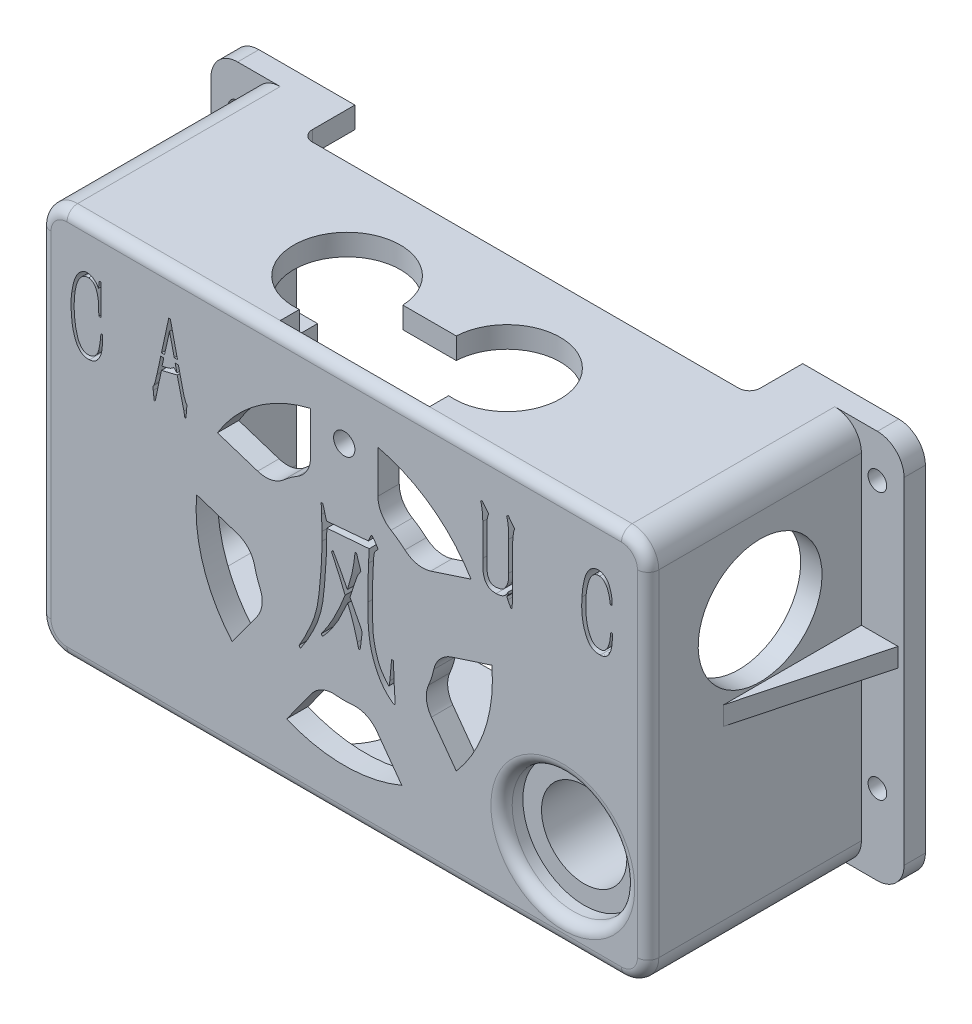
from build123d import *

# Parameters (mm, degrees)
SKETCH_1_R           = 1.75
EXTRUDE_1_DEPTH      = 4
EXTRUDE_2_DEPTH      = 36
EXTRUDE_START        = -15
SKETCH_3_R           = 8
EXTRUDE_3_DEPTH      = 15
SKETCH_4_R           = 11.5
EXTRUDE_4_DEPTH      = 4
FILLET_1_R           = 2
CUT_EXTRUDE_1_DEPTH  = 100
SKETCH_8_R           = 10
CUT_EXTRUDE_2_DEPTH  = 100
SKETCH_9_R           = 9.298841846
CUT_EXTRUDE_3_DEPTH  = 4
SKETCH_10_R          = 11.613625498
CUT_EXTRUDE_4_DEPTH  = 4
CUT_EXTRUDE_5_DEPTH  = 4
CUT_EXTRUDE_6_DEPTH  = 4
CUT_EXTRUDE_9_DEPTH  = 4
SKETCH_18_W          = 28
SKETCH_18_H          = 14
CUT_EXTRUDE_10_DEPTH = 4
SKETCH_19_R          = 2
CUT_EXTRUDE_11_DEPTH = 4
SKETCH_20_W          = 1.60747687
SKETCH_20_H          = 0.595361804
SKETCH_20_W_2        = 1.763369689
SKETCH_20_H_2        = 0.790958503
EXTRUDE_5_DEPTH      = 4
SKETCH_21_W          = 4
SKETCH_21_H          = 7
EXTRUDE_6_DEPTH      = 5
EXTRUDE_8_DEPTH      = 3.5
SKETCH_24_W          = 9.548890683
SKETCH_24_H          = 8
CUT_EXTRUDE_12_DEPTH = 4
FILLET_2_R           = 2


with BuildPart() as part:
    # 草图1 → 凸台-拉伸1 (new body)
    with BuildSketch(Plane.XY):
        with BuildLine():
            Line((-98.4546875, 27.486072711), (21.5453125, 27.486072711))
            ThreePointArc((21.5453125, 27.486072711), (25.080846406, 26.021606617), (26.5453125, 22.486072711))
            Line((26.5453125, 22.486072711), (26.5453125, -40.513927289))
            ThreePointArc((26.5453125, -40.513927289), (25.080846406, -44.049461195), (21.5453125, -45.513927289))
            Line((21.5453125, -45.513927289), (-98.4546875, -45.513927289))
            ThreePointArc((-98.4546875, -45.513927289), (-101.990221406, -44.049461195), (-103.4546875, -40.513927289))
            Line((-103.4546875, -40.513927289), (-103.4546875, 22.486072711))
            ThreePointArc((-103.4546875, 22.486072711), (-101.990221406, 26.021606617), (-98.4546875, 27.486072711))
        make_face()
        with Locations((-98.4546875, 19.486072711)):
            Circle(SKETCH_1_R, mode=Mode.SUBTRACT)
        with Locations((-98.4546875, -30.513927289)):
            Circle(SKETCH_1_R, mode=Mode.SUBTRACT)
        with Locations((21.5453125, 19.486072711)):
            Circle(SKETCH_1_R, mode=Mode.SUBTRACT)
        with Locations((21.5453125, -30.513927289)):
            Circle(SKETCH_1_R, mode=Mode.SUBTRACT)
        with BuildLine():
            Line((-86.4546875, 23.486072711), (9.5453125, 23.486072711))
            ThreePointArc((9.5453125, 23.486072711), (13.080846406, 22.021606617), (14.5453125, 18.486072711))
            Line((14.5453125, 18.486072711), (14.5453125, -36.513927289))
            ThreePointArc((14.5453125, -36.513927289), (13.080846406, -40.049461195), (9.5453125, -41.513927289))
            Line((9.5453125, -41.513927289), (-86.4546875, -41.513927289))
            ThreePointArc((-86.4546875, -41.513927289), (-89.990221406, -40.049461195), (-91.4546875, -36.513927289))
            Line((-91.4546875, -36.513927289), (-91.4546875, 18.486072711))
            ThreePointArc((-91.4546875, 18.486072711), (-89.990221406, 22.021606617), (-86.4546875, 23.486072711))
        make_face(mode=Mode.SUBTRACT)
    extrude(amount=EXTRUDE_1_DEPTH)

    # 草图2 → 凸台-拉伸2 (add)
    with BuildSketch(Plane.XY.offset(4)):
        with BuildLine():
            Line((-90.4546875, 27.486072711), (13.5453125, 27.486072711))
            ThreePointArc((13.5453125, 27.486072711), (17.080846406, 26.021606617), (18.5453125, 22.486072711))
            Line((18.5453125, 22.486072711), (18.5453125, -40.513927289))
            ThreePointArc((18.5453125, -40.513927289), (17.080846406, -44.049461195), (13.5453125, -45.513927289))
            Line((13.5453125, -45.513927289), (-90.4546875, -45.513927289))
            ThreePointArc((-90.4546875, -45.513927289), (-93.990221406, -44.049461195), (-95.4546875, -40.513927289))
            Line((-95.4546875, -40.513927289), (-95.4546875, 22.486072711))
            ThreePointArc((-95.4546875, 22.486072711), (-93.990221406, 26.021606617), (-90.4546875, 27.486072711))
        make_face()
        with BuildLine():
            Line((-86.4546875, 23.486072711), (9.5453125, 23.486072711))
            ThreePointArc((9.5453125, 23.486072711), (13.080846406, 22.021606617), (14.5453125, 18.486072711))
            Line((14.5453125, 18.486072711), (14.5453125, -36.513927289))
            ThreePointArc((14.5453125, -36.513927289), (13.080846406, -40.049461195), (9.5453125, -41.513927289))
            Line((9.5453125, -41.513927289), (-86.4546875, -41.513927289))
            ThreePointArc((-86.4546875, -41.513927289), (-89.990221406, -40.049461195), (-91.4546875, -36.513927289))
            Line((-91.4546875, -36.513927289), (-91.4546875, 18.486072711))
            ThreePointArc((-91.4546875, 18.486072711), (-89.990221406, 22.021606617), (-86.4546875, 23.486072711))
        make_face(mode=Mode.SUBTRACT)
    extrude(amount=EXTRUDE_2_DEPTH)

    # 草图3 → 凸台-拉伸3 (add)
    with BuildSketch(Plane.XY.offset(40).offset(EXTRUDE_START)):
        with BuildLine():
            Line((13.5453125, -45.513927289), (-9.4546875, -45.513927289))
            Line((-9.4546875, -45.513927289), (-9.4546875, -22.513927289))
            ThreePointArc((-9.4546875, -22.513927289), (-7.990221406, -18.978393383), (-4.4546875, -17.513927289))
            Line((-4.4546875, -17.513927289), (18.5453125, -17.513927289))
            Line((18.5453125, -17.513927289), (18.5453125, -40.513927289))
            ThreePointArc((18.5453125, -40.513927289), (17.080846406, -44.049461195), (13.5453125, -45.513927289))
        make_face()
        with Locations((2.5453125, -29.513927289)):
            Circle(SKETCH_3_R, mode=Mode.SUBTRACT)
    extrude(amount=EXTRUDE_3_DEPTH)

    # 草图4 → 凸台-拉伸4 (add)
    with BuildSketch(Plane.XY.offset(40)):
        with BuildLine():
            Line((-90.4546875, -45.513927289), (13.5453125, -45.513927289))
            ThreePointArc((13.5453125, -45.513927289), (17.080846406, -44.049461195), (18.5453125, -40.513927289))
            Line((18.5453125, -40.513927289), (18.5453125, 22.486072711))
            ThreePointArc((18.5453125, 22.486072711), (17.080846406, 26.021606617), (13.5453125, 27.486072711))
            Line((13.5453125, 27.486072711), (-90.4546875, 27.486072711))
            ThreePointArc((-90.4546875, 27.486072711), (-93.990221406, 26.021606617), (-95.4546875, 22.486072711))
            Line((-95.4546875, 22.486072711), (-95.4546875, -40.513927289))
            ThreePointArc((-95.4546875, -40.513927289), (-93.990221406, -44.049461195), (-90.4546875, -45.513927289))
        make_face()
        with Locations((2.5453125, -29.513927289)):
            Circle(SKETCH_4_R, mode=Mode.SUBTRACT)
    extrude(amount=EXTRUDE_4_DEPTH)

    # 圆角1
    fillet_1_edges = [part.edges().sort_by_distance(p)[0] for p in [
        (-8.9546875, -29.513927289, 44),
        (18.5453125, -9.013927289, 44),
        (17.080846406, -44.049461195, 44),
        (-38.4546875, -45.513927289, 44),
        (-93.990221406, -44.049461195, 44),
        (-95.4546875, -9.013927289, 44),
        (-93.990221406, 26.021606617, 44),
        (-38.4546875, 27.486072711, 44),
        (17.080846406, 26.021606617, 44),
    ]]
    fillet(fillet_1_edges, radius=FILLET_1_R)

    # 草图5 → 切除-拉伸1 (cut)
    with BuildSketch(Plane.XZ.offset(45.513927289)):
        with BuildLine():
            Line((-80.4546875, 0), (3.5453125, 0))
            Line((3.5453125, 0), (3.5453125, 2))
            Line((3.5453125, 2), (3.5453125, 8))
            ThreePointArc((3.5453125, 8), (2.959526062, 9.414213562), (1.5453125, 10))
            Line((1.5453125, 10), (-78.4546875, 10))
            ThreePointArc((-78.4546875, 10), (-79.868901062, 9.414213562), (-80.4546875, 8))
            Line((-80.4546875, 8), (-80.4546875, 2))
            Line((-80.4546875, 2), (-80.4546875, 0))
        make_face()
    extrude(amount=-CUT_EXTRUDE_1_DEPTH, mode=Mode.SUBTRACT)

    # 草图8 → 切除-拉伸2 (cut)
    with BuildSketch(Plane.XZ.offset(45.513927289)):
        with Locations((-53.4546875, 28.467259799)):
            Circle(SKETCH_8_R)
        with Locations((-23.4546875, 28.467259799)):
            Circle(SKETCH_8_R)
    extrude(amount=-CUT_EXTRUDE_2_DEPTH, mode=Mode.SUBTRACT)

    # 草图9 → 切除-拉伸3 (cut)
    with BuildSketch(Plane.ZY.offset(95.4546875)):
        with Locations((23, 9.298841846)):
            Circle(SKETCH_9_R)
        with Locations((23, -20.701158154)):
            Circle(SKETCH_9_R)
    extrude(amount=-CUT_EXTRUDE_3_DEPTH, mode=Mode.SUBTRACT)

    # 草图10 → 切除-拉伸4 (cut)
    with BuildSketch(Plane(origin=(18.5453125, 0, 0), x_dir=(0, 0, -1), z_dir=(1, 0, 0))):
        with Locations((-23, 6.381763577)):
            Circle(SKETCH_10_R)
    extrude(amount=-CUT_EXTRUDE_4_DEPTH, mode=Mode.SUBTRACT)

    # 草图11 → 切除-拉伸5 (cut)
    with BuildSketch(Plane.XY.offset(44)):
        with BuildLine():
            Line((-32.137855058, 18.04582168), (-32.137855058, 10.106075082))
            ThreePointArc((-32.137855058, 10.106075082), (-31.481458567, 7.629563714), (-29.684611635, 5.803281695))
            ThreePointArc((-29.684611635, 5.803281695), (-28.334126115, 4.915830426), (-27.072786827, 3.905679896))
            ThreePointArc((-27.072786827, 3.905679896), (-24.780633174, 2.761129093), (-22.222493228, 2.902143033))
            Line((-22.222493228, 2.902143033), (-14.671345489, 5.355659663))
            ThreePointArc((-14.671345489, 5.355659663), (-22.121739862, 13.466446547), (-32.137855058, 18.04582168))
        make_face()
        with BuildLine():
            Line((-44.771519942, 18.04582168), (-44.771519942, 10.106075082))
            ThreePointArc((-44.771519942, 10.106075082), (-45.427916433, 7.629563714), (-47.224763365, 5.803281695))
            ThreePointArc((-47.224763365, 5.803281695), (-48.575248885, 4.915830426), (-49.836588173, 3.905679896))
            ThreePointArc((-49.836588173, 3.905679896), (-52.128741826, 2.761129093), (-54.686881772, 2.902143033))
            Line((-54.686881772, 2.902143033), (-62.238029511, 5.355659662))
            ThreePointArc((-62.238029511, 5.355659662), (-54.787635138, 13.466446547), (-44.771519942, 18.04582168))
        make_face()
        with BuildLine():
            Line((-10.767328339, -6.659669651), (-18.318476078, -9.113186281))
            ThreePointArc((-18.318476078, -9.113186281), (-20.470940681, -10.50274054), (-21.652581858, -12.775995704))
            ThreePointArc((-21.652581858, -12.775995704), (-22.079275194, -14.334621281), (-22.650210162, -15.846379911))
            ThreePointArc((-22.650210162, -15.846379911), (-23.030428229, -18.380033229), (-22.105807286, -20.769393189))
            Line((-22.105807286, -20.769393189), (-17.438941329, -27.192783118))
            ThreePointArc((-17.438941329, -27.192783118), (-12.027423086, -17.600666015), (-10.767328339, -6.659669651))
        make_face()
        with BuildLine():
            Line((-27.659790922, -34.618665019), (-32.326656879, -28.195275091))
            ThreePointArc((-32.326656879, -28.195275091), (-34.313349654, -26.577555484), (-36.840490996, -26.156222421))
            ThreePointArc((-36.840490996, -26.156222421), (-38.4546875, -26.232054735), (-40.068884004, -26.156222421))
            ThreePointArc((-40.068884004, -26.156222421), (-42.596025346, -26.577555484), (-44.582718121, -28.195275091))
            Line((-44.582718121, -28.195275091), (-49.249584078, -34.618665019))
            ThreePointArc((-49.249584078, -34.618665019), (-38.4546875, -36.801197511), (-27.659790922, -34.618665019))
        make_face()
        with BuildLine():
            Line((-59.470433671, -27.192783118), (-54.803567714, -20.769393189))
            ThreePointArc((-54.803567714, -20.769393189), (-53.878946771, -18.380033229), (-54.259164838, -15.846379911))
            ThreePointArc((-54.259164838, -15.846379911), (-54.830099806, -14.334621281), (-55.256793142, -12.775995704))
            ThreePointArc((-55.256793142, -12.775995704), (-56.438434319, -10.50274054), (-58.590898922, -9.113186281))
            Line((-58.590898922, -9.113186281), (-66.142046661, -6.659669651))
            ThreePointArc((-66.142046661, -6.659669651), (-64.881951914, -17.600666015), (-59.470433671, -27.192783118))
        make_face()
    extrude(amount=-CUT_EXTRUDE_5_DEPTH, mode=Mode.SUBTRACT)

    # 草图16 → 切除-拉伸6 (cut)
    with BuildSketch(Plane.XY.offset(44)):
        with BuildLine():
            Line((-41.77893756, 1.251305155), (-33.924686548, 1.941695097))
            Line((-33.924686548, 1.941695097), (-33.49425825, 2.917616683))
            add(Edge.make_bspline(
                [(-33.49425825, 2.917616683), (-33.462702516, 2.973664367), (-33.414824111, 3.058703546), (-33.327839457, 3.174582553), (-33.244743366, 3.144028695), (-33.174025097, 3.088787557), (-33.083108577, 2.987197192), (-33.013910249, 2.907687495), (-32.97433496, 2.862215021)],
                knots=[0, 0, 0, 0, 1.605878033, 2.436542221, 2.81783149, 3.513699471, 4.578057225, 6, 6, 6, 6], degree=3))
            Line((-32.97433496, 2.862215021), (-32.369178344, 1.941695097))
            add(Edge.make_bspline(
                [(-32.369178344, 1.941695097), (-32.336911641, 1.889047188), (-32.279748014, 1.795776256), (-32.200263366, 1.675287961), (-32.167419405, 1.580569794), (-32.148867414, 1.506524944), (-32.183389378, 1.437581011), (-32.239842573, 1.353827698), (-32.331168114, 1.240233693), (-32.440579676, 1.104480748), (-32.561982241, 0.972436792), (-32.651096223, 0.841697314), (-32.729345264, 0.74196588), (-32.77609433, 0.647261273), (-32.808983727, 0.545242122), (-32.835892364, 0.417589782), (-32.871376421, 0.256198577), (-32.906336589, 0.050194607), (-32.942880517, -0.218007059), (-32.962880588, -0.569803852), (-32.991696468, -1.009867599), (-32.99977521, -1.334041376), (-33.004166624, -1.510254615)],
                knots=[0, 0, 0, 0, 0.995941378, 1.764407796, 2.299558316, 2.622854568, 2.941264449, 3.486572369, 4.268521683, 5.275422138, 6.297007601, 7.147467259, 7.819814652, 8.33099091, 8.837029588, 9.54126649, 10.429007622, 11.496374984, 12.902806579, 14.78237881, 17.163823858, 20, 20, 20, 20], degree=3))
            Line((-33.004166624, -1.510254615), (-33.149063279, -5.021867656))
            add(Edge.make_bspline(
                [(-33.149063279, -5.021867656), (-33.164030461, -5.447998515), (-33.193660609, -6.291598871), (-33.180932159, -7.135619813), (-33.174633277, -7.553297445)],
                knots=[0, 0, 0, 0, 1.010267138, 2, 2, 2, 2], degree=3))
            add(Edge.make_bspline(
                [(-33.174633277, -7.553297445), (-33.174939562, -7.686831055), (-33.175601021, -7.975213348), (-33.169798947, -8.43687969), (-33.165666081, -8.959642194), (-33.162066741, -9.753866222), (-33.13463822, -10.836740171), (-33.086340508, -11.969788926), (-33.002832653, -12.931461797), (-32.882922584, -13.695858979), (-32.728075719, -14.493438154), (-32.521386496, -15.29689168), (-32.295139383, -16.065395075), (-32.056779779, -16.753835919), (-31.801340204, -17.335812781), (-31.539645185, -17.822336714), (-31.268988055, -18.224507541), (-31.030188369, -18.585208986), (-30.798110729, -18.895052708), (-30.589883837, -19.16297135), (-30.404778292, -19.368681731), (-30.256316644, -19.53392763), (-30.167081474, -19.621394877), (-30.085336587, -19.714698014), (-30.018381152, -19.597901902), (-29.995403088, -19.434184897), (-29.943732685, -19.122998225), (-29.914488831, -18.881307064), (-29.897411883, -18.740171513)],
                knots=[0, 0, 0, 0, 0.751213448, 1.62233804, 2.597349948, 3.692232756, 6.090375044, 8.690801151, 10.071296379, 11.517980521, 13.041387744, 14.640453284, 16.182859045, 17.5477681, 18.73570215, 19.75490947, 20.650435981, 21.461694926, 22.187350993, 22.830118739, 23.362387856, 23.763962415, 24.029616587, 24.16710983, 24.280692267, 24.619936828, 25.194112121, 26, 26, 26, 26], degree=3))
            Line((-29.897411883, -18.740171513), (-29.582048576, -15.147586812))
            Line((-29.582048576, -15.147586812), (-29.236853605, -15.147586812))
            add(Edge.make_bspline(
                [(-29.236853605, -15.147586812), (-29.221735079, -15.433078487), (-29.193234209, -15.971276504), (-29.166843253, -16.728704197), (-29.137799232, -17.387667098), (-29.124546067, -17.950438523), (-29.1039257, -18.426143973), (-29.095531889, -18.819937445), (-29.075748576, -19.13789969), (-29.066255629, -19.324013918), (-29.062125286, -19.404991457)],
                knots=[0, 0, 0, 0, 1.610195536, 3.035479211, 4.268572226, 5.325192611, 6.2058873, 6.950369873, 7.543310228, 8, 8, 8, 8], degree=3))
            Line((-29.062125286, -19.404991457), (-28.947060296, -21.101134649))
            Line((-28.947060296, -21.101134649), (-28.917228632, -21.476161285))
            Line((-28.917228632, -21.476161285), (-28.891658634, -21.936421246))
            add(Edge.make_bspline(
                [(-28.891658634, -21.936421246), (-28.892750935, -21.977883477), (-28.894591937, -22.047765414), (-28.916653114, -22.136848024), (-28.967235931, -22.196795146), (-29.011363605, -22.193624894), (-29.032293622, -22.192121225)],
                knots=[0, 0, 0, 0, 1.479600553, 2.493772011, 3.285587173, 4, 4, 4, 4], degree=3))
            add(Edge.make_bspline(
                [(-29.032293622, -22.192121225), (-29.068309859, -22.188276258), (-29.150837364, -22.179465911), (-29.279055812, -22.114596271), (-29.433920329, -22.025885007), (-29.608957942, -21.895843499), (-29.81363202, -21.737357615), (-30.035784865, -21.536603391), (-30.282850861, -21.300579234), (-30.655383318, -20.939164622), (-31.118337665, -20.409562567), (-31.633959161, -19.677914555), (-32.120572454, -18.849236167), (-32.557461769, -17.92966182), (-32.948967901, -16.96088788), (-33.274494787, -15.966930871), (-33.530362024, -14.965993357), (-33.715376313, -13.965521537), (-33.838077068, -12.992233125), (-33.946417602, -12.070908467), (-34.008736515, -11.209110849), (-34.041895257, -10.413166193), (-34.055329739, -9.695531626), (-34.050576303, -9.067629949), (-34.056897034, -8.536196582), (-34.045068036, -8.213840693), (-34.039751538, -8.068959068)],
                knots=[0, 0, 0, 0, 0.164943676, 0.377951475, 0.649474437, 0.985733318, 1.375430102, 1.836930395, 2.357672984, 2.942744343, 4.216899666, 5.576326546, 7.04227667, 8.618676554, 10.241000277, 11.83148603, 13.411597119, 14.975603422, 16.494032559, 17.909907258, 19.229537073, 20.455443584, 21.563146216, 22.520834089, 23.335194525, 24, 24, 24, 24], degree=3))
            add(Edge.make_bspline(
                [(-34.039751538, -8.068959068), (-34.037838473, -7.583121414), (-34.034045731, -6.619924889), (-34.015462248, -5.4053406), (-33.993293667, -4.396738073), (-33.96749622, -3.55859008), (-33.93197302, -2.635327225), (-33.907604297, -1.991824103), (-33.894854884, -1.65515127)],
                knots=[0, 0, 0, 0, 1.363026979, 2.702266564, 3.407860853, 4.193346914, 5.054781565, 6, 6, 6, 6], degree=3))
            Line((-33.894854884, -1.65515127), (-33.779789893, 0.761213529))
            Line((-33.779789893, 0.761213529), (-41.719274232, 0.130486915))
            add(Edge.make_bspline(
                [(-41.719274232, 0.130486915), (-41.718578329, -0.010154806), (-41.71712313, -0.304250164), (-41.729097297, -0.763024523), (-41.735330162, -1.260283974), (-41.749583781, -1.781571199), (-41.760809468, -2.301529674), (-41.775454594, -2.790125302), (-41.782335509, -3.236247961), (-41.790811492, -3.588515501), (-41.795585054, -3.875527084), (-41.804449686, -4.122719159), (-41.818490028, -4.406715439), (-41.829806376, -4.727886282), (-41.847580526, -5.08584274), (-41.868529043, -5.482202143), (-41.895431331, -5.915316505), (-41.919665065, -6.384254042), (-41.948987594, -6.887268186), (-41.987529576, -7.424266552), (-42.03538645, -7.993727038), (-42.086478914, -8.594625685), (-42.141211346, -9.226968293), (-42.20508934, -9.891818612), (-42.27940283, -10.58898844), (-42.375791087, -11.556435925), (-42.545605374, -12.768735644), (-42.868264775, -14.193199707), (-43.292655084, -15.57572097), (-43.83539937, -16.9078056), (-44.459700623, -18.19834522), (-45.131408641, -19.46151013), (-45.862894293, -20.692108153), (-46.398825286, -21.481601607), (-46.667068819, -21.876757918)],
                knots=[0, 0, 0, 0, 0.586986382, 1.227444952, 1.915329195, 2.662614497, 3.403972338, 4.086057177, 4.702803347, 5.266197918, 5.556787027, 5.900882432, 6.298533869, 6.743576129, 7.242189542, 7.794397347, 8.400216613, 9.053393209, 9.754263515, 10.503240467, 11.300419762, 12.139452861, 13.020346579, 13.949560813, 14.9271525, 15.946639689, 18.007701429, 20.031568048, 22.036367955, 24.036919806, 26.028568901, 28.017975038, 30.006921675, 32, 32, 32, 32], degree=3))
            Line((-46.667068819, -21.876757918), (-46.927030464, -21.501731282))
            add(Edge.make_bspline(
                [(-46.927030464, -21.501731282), (-46.853572864, -21.390135727), (-46.692224341, -21.145017752), (-46.452944854, -20.730492313), (-46.184426973, -20.244584981), (-45.886893307, -19.677975487), (-45.55371247, -19.017452815), (-45.201773936, -18.24028751), (-44.802509566, -17.353546953), (-44.4548758, -16.540289814), (-44.176134269, -15.829613519), (-43.979350432, -15.251059075), (-43.802291502, -14.643428919), (-43.639042032, -14.005483032), (-43.495701252, -13.337081487), (-43.366849149, -12.639609625), (-43.262393342, -11.911216317), (-43.170437924, -11.165075716), (-43.092279415, -10.42019149), (-43.019320751, -9.700012312), (-42.955178384, -9.015298377), (-42.90095897, -8.365873652), (-42.848344369, -7.752423845), (-42.805710889, -7.174219976), (-42.772451704, -6.631408535), (-42.732483876, -5.961072505), (-42.692211542, -5.161418574), (-42.66570917, -4.232117742), (-42.640041542, -3.335805734), (-42.639875673, -2.74899756), (-42.639794155, -2.460606203)],
                knots=[0, 0, 0, 0, 0.56611054, 1.24345336, 2.027610168, 2.918996709, 3.955574055, 5.162361968, 6.534077478, 8.077182375, 8.910111978, 9.768753993, 10.666037312, 11.591791413, 12.558905963, 13.562636501, 14.597113738, 15.676900542, 16.74863478, 17.771218548, 18.744702091, 19.66314501, 20.533088881, 21.354074887, 22.120182263, 22.837849342, 24.200072447, 25.513198009, 26.777842174, 28, 28, 28, 28], degree=3))
            Line((-42.639794155, -2.460606203), (-42.639794155, -0.879528001))
            add(Edge.make_bspline(
                [(-42.639794155, -0.879528001), (-42.644055454, -0.673547381), (-42.652019932, -0.288564285), (-42.663164271, 0.249863998), (-42.680724765, 0.711387922), (-42.679214233, 1.095135535), (-42.691989451, 1.401830104), (-42.693283554, 1.630631524), (-42.69998194, 1.78256546), (-42.699584826, 1.857880456), (-42.699457483, 1.882031769)],
                knots=[0, 0, 0, 0, 1.790050201, 3.345650026, 4.679157698, 5.802395961, 6.679063369, 7.345674392, 7.790176949, 8, 8, 8, 8], degree=3))
            Line((-42.699457483, 1.882031769), (-42.784690809, 3.75290328))
            Line((-42.784690809, 3.75290328), (-42.469327502, 3.782734944))
            Line((-42.469327502, 3.782734944), (-41.77893756, 1.251305155))
        make_face()
        with BuildLine():
            add(Edge.make_bspline(
                [(-37.866727886, -7.924062414), (-37.798380772, -7.699665003), (-37.666126918, -7.265448827), (-37.477129261, -6.635538526), (-37.312208044, -6.046624266), (-37.161992434, -5.50318436), (-37.03426544, -5.004465414), (-36.925450103, -4.550273382), (-36.841727429, -4.138985329), (-36.710547348, -3.435105282), (-36.567594184, -2.449178066), (-36.472272254, -1.582961457), (-36.426284673, -1.165059644)],
                knots=[0, 0, 0, 0, 1.015996721, 1.965986185, 2.848314102, 3.664770525, 4.407923851, 5.078003328, 5.687369064, 6.225580776, 8.179050571, 10, 10, 10, 10], degree=3))
            Line((-36.426284673, -1.165059644), (-36.166323028, -1.109657982))
            Line((-36.166323028, -1.109657982), (-35.335298097, -3.696489433))
            add(Edge.make_bspline(
                [(-35.335298097, -3.696489433), (-35.464125621, -3.887252735), (-35.703929901, -4.242346544), (-35.956169207, -4.721812223), (-36.122118586, -5.151964907), (-36.273892725, -5.581187209), (-36.466823791, -6.123914676), (-36.675199487, -6.751535349), (-36.88467683, -7.391496587), (-37.078667955, -7.97417061), (-37.233984736, -8.470206489), (-37.332312972, -8.769385251), (-37.37663626, -8.904245666)],
                knots=[0, 0, 0, 0, 1.229267302, 2.288203257, 2.884286614, 3.690828183, 4.720454213, 5.961122752, 7.223395767, 8.317688295, 9.241666581, 10, 10, 10, 10], degree=3))
            Line((-37.37663626, -8.904245666), (-35.360868095, -12.81645534))
            add(Edge.make_bspline(
                [(-35.360868095, -12.81645534), (-35.325707399, -12.892770827), (-35.264359739, -13.025924523), (-35.194876077, -13.210079819), (-35.135299954, -13.364992953), (-35.127657546, -13.53988989), (-35.14106477, -13.768222571), (-35.153252808, -13.945757316), (-35.160569778, -14.05233857)],
                knots=[0, 0, 0, 0, 1.18119007, 2.060916176, 2.775212012, 3.49729635, 4.497526248, 6, 6, 6, 6], degree=3))
            Line((-35.160569778, -14.05233857), (-35.390699759, -15.953041745))
            add(Edge.make_bspline(
                [(-35.390699759, -15.953041745), (-35.405255224, -16.041163659), (-35.430576189, -16.194462234), (-35.475497811, -16.390433383), (-35.534865506, -16.514268269), (-35.613403599, -16.582437225), (-35.695206728, -16.562961), (-35.752454044, -16.504296561), (-35.794192523, -16.412404919), (-35.811309374, -16.339853909), (-35.821128056, -16.298236716)],
                knots=[0, 0, 0, 0, 2.045596861, 3.558559588, 4.561956222, 5.19272346, 5.72155992, 6.296298859, 7.022711603, 8, 8, 8, 8], degree=3))
            Line((-35.821128056, -16.298236716), (-35.995856375, -15.518351781))
            add(Edge.make_bspline(
                [(-35.995856375, -15.518351781), (-36.108178387, -15.072565674), (-36.335351133, -14.170957414), (-36.758607008, -12.821077389), (-37.247414641, -11.453784951), (-37.618891497, -10.545050327), (-37.807064558, -10.084727234)],
                knots=[0, 0, 0, 0, 0.961965759, 1.945588392, 2.959329732, 4, 4, 4, 4], degree=3))
            add(Edge.make_bspline(
                [(-37.807064558, -10.084727234), (-37.852568665, -10.177040208), (-37.949758518, -10.374206683), (-38.103536868, -10.688725597), (-38.269522916, -11.042588788), (-38.513977754, -11.582887331), (-38.859533747, -12.327732689), (-39.227658051, -13.126676872), (-39.593489872, -13.830468135), (-39.948701825, -14.427672894), (-40.373756221, -15.087137416), (-40.771866202, -15.662563742), (-41.11286224, -16.127640429), (-41.354415502, -16.463196474), (-41.588637584, -16.766654038), (-41.80497087, -17.04566333), (-42.011084107, -17.293103027), (-42.20107209, -17.514986082), (-42.380783616, -17.707809418), (-42.498792356, -17.824275482), (-42.554560829, -17.879314918)],
                knots=[0, 0, 0, 0, 0.605609392, 1.293489561, 2.060060433, 2.905435967, 4.782994602, 6.891849486, 8.080827224, 9.448488343, 10.97882466, 12.697000752, 13.564768003, 14.372309685, 15.129664591, 15.820281897, 16.449598567, 17.024427966, 17.538964975, 18, 18, 18, 18], degree=3))
            Line((-42.554560829, -17.879314918), (-42.754859145, -17.534119946))
            add(Edge.make_bspline(
                [(-42.754859145, -17.534119946), (-42.551686174, -17.257685945), (-42.130750762, -16.684967734), (-41.535184123, -15.75666824), (-40.931689606, -14.74664948), (-40.346253583, -13.656719569), (-39.770739507, -12.526818653), (-39.239393092, -11.372054247), (-38.742987275, -10.216474135), (-38.445128227, -9.436581593), (-38.297156183, -9.04914232)],
                knots=[0, 0, 0, 0, 0.856149875, 1.77377827, 2.75163742, 3.792490953, 4.861314199, 5.916331696, 6.964863889, 8, 8, 8, 8], degree=3))
            add(Edge.make_bspline(
                [(-38.297156183, -9.04914232), (-38.374985505, -8.851565418), (-38.535962003, -8.442911753), (-38.791604522, -7.811541878), (-39.072104433, -7.143478142), (-39.380893273, -6.440309053), (-39.709030943, -5.69877371), (-40.056974395, -4.918960139), (-40.433288125, -4.104102983), (-40.694660279, -3.549987132), (-40.828585972, -3.266061135)],
                knots=[0, 0, 0, 0, 0.807151559, 1.669453458, 2.589037926, 3.56108659, 4.588486371, 5.671261893, 6.806767057, 8, 8, 8, 8], degree=3))
            Line((-40.828585972, -3.266061135), (-40.568624327, -2.920866164))
            add(Edge.make_bspline(
                [(-40.568624327, -2.920866164), (-40.340565443, -3.307432968), (-39.876009034, -4.094870331), (-39.208010362, -5.321426757), (-38.525776989, -6.597677094), (-38.088935402, -7.476853267), (-37.866727886, -7.924062414)],
                knots=[0, 0, 0, 0, 0.946892055, 1.928821038, 2.946456687, 4, 4, 4, 4], degree=3))
        make_face()
    extrude(amount=-CUT_EXTRUDE_6_DEPTH, mode=Mode.SUBTRACT)

    # 草图17 → 切除-拉伸9 (cut)
    # profile 1 of 4: a face of its own
    with BuildSketch(Plane.XY.offset(44)):
        with BuildLine():
            Line((-84.545909244, 17.652503741), (-84.392489257, 18.924611135))
            Line((-84.392489257, 18.924611135), (-84.069668034, 18.924611135))
            Line((-84.069668034, 18.924611135), (-84.069668034, 13.164969115))
            Line((-84.069668034, 13.164969115), (-84.478787999, 13.164969115))
            add(Edge.make_bspline(
                [(-84.478787999, 13.164969115), (-84.479347756, 13.269389929), (-84.480518882, 13.48786009), (-84.493017546, 13.83721128), (-84.500995801, 14.235751164), (-84.514574371, 14.685336803), (-84.52733402, 15.166709134), (-84.574434232, 15.659613932), (-84.646438992, 16.157770566), (-84.756323253, 16.657454003), (-84.900823648, 17.139311658), (-85.071556447, 17.506067386), (-85.230971068, 17.763584349), (-85.361556877, 17.930989448), (-85.507114701, 18.07362621), (-85.715411876, 18.228817592), (-85.999899677, 18.385169662), (-86.251652223, 18.429453723), (-86.377360341, 18.451566174)],
                knots=[0, 0, 0, 0, 0.822473136, 1.720785642, 2.753326599, 3.962261781, 5.264018637, 6.545024146, 7.860049611, 9.226346671, 10.572050264, 11.814683136, 12.399128484, 12.954850798, 13.483022901, 13.998303406, 15.000488703, 16, 16, 16, 16], degree=3))
            add(Edge.make_bspline(
                [(-86.377360341, 18.451566174), (-86.473469885, 18.454130077), (-86.66528475, 18.4592471), (-86.950464164, 18.401578712), (-87.225182834, 18.29394705), (-87.48875108, 18.137987645), (-87.739829945, 17.937561513), (-87.96251254, 17.681160097), (-88.174258001, 17.386809547), (-88.349873531, 17.042138353), (-88.505495, 16.67171056), (-88.650256024, 16.286305316), (-88.762532246, 15.884621818), (-88.883980106, 15.338863977), (-88.991965065, 14.661823125), (-89.069548887, 13.873709067), (-89.110101462, 13.137755433), (-89.124373104, 12.451141636), (-89.110276662, 11.791276749), (-89.086854859, 11.355837362), (-89.074995116, 11.135350534)],
                knots=[0, 0, 0, 0, 0.603095173, 1.203653813, 1.814626149, 2.451293107, 3.123130818, 3.825388984, 4.580186105, 5.398460658, 6.251023789, 7.107448911, 7.985514538, 8.871470416, 10.622993602, 12.29317529, 13.850163291, 15.257553743, 16.61134915, 18, 18, 18, 18], degree=3))
            add(Edge.make_bspline(
                [(-89.074995116, 11.135350534), (-89.057750688, 10.938171867), (-89.022464841, 10.534701497), (-88.963736714, 10.022872214), (-88.895832888, 9.589607492), (-88.828505044, 9.232574776), (-88.744580693, 8.845909844), (-88.650416918, 8.444469811), (-88.544435671, 8.060408664), (-88.444925251, 7.719833493), (-88.34461955, 7.441692602), (-88.212637485, 7.154589992), (-88.025901439, 6.853281091), (-87.783317035, 6.528526945), (-87.511292955, 6.259835473), (-87.21965511, 6.055308904), (-86.894272772, 5.936427906), (-86.667056412, 5.922864683), (-86.549957827, 5.915874719)],
                knots=[0, 0, 0, 0, 1.515526627, 3.101096572, 3.943353373, 4.87293365, 5.882541642, 6.972773351, 8.029529644, 8.932786276, 9.68898916, 10.291221641, 11.348890653, 12.39638072, 13.388602443, 14.264213047, 15.105442077, 16, 16, 16, 16], degree=3))
            add(Edge.make_bspline(
                [(-86.549957827, 5.915874719), (-86.440831588, 5.914402605), (-86.218606224, 5.911404784), (-85.887616863, 5.995581816), (-85.566315647, 6.130048477), (-85.266198359, 6.328594319), (-85.001400682, 6.592182277), (-84.776197579, 6.920165601), (-84.59761078, 7.310794377), (-84.47420739, 7.757039042), (-84.374647362, 8.238485647), (-84.309928979, 8.649331976), (-84.264132794, 8.959851339), (-84.234500958, 9.146017832), (-84.215919185, 9.284763061), (-84.205015511, 9.360372189), (-84.200714273, 9.39019818)],
                knots=[0, 0, 0, 0, 0.974493461, 1.984464659, 3.032762083, 4.086915356, 5.187622472, 6.361151533, 7.634420725, 9.018373663, 10.501751059, 12.040324543, 12.745324753, 13.31527632, 13.729892907, 14, 14, 14, 14], degree=3))
            Line((-84.200714273, 9.39019818), (-84.092041782, 10.531259334))
            Line((-84.092041782, 10.531259334), (-83.74684681, 10.512081836))
            add(Edge.make_bspline(
                [(-83.74684681, 10.512081836), (-83.746416545, 10.405536024), (-83.745633435, 10.211616148), (-83.750392976, 9.947424229), (-83.751325396, 9.737438797), (-83.759887356, 9.566002478), (-83.765444621, 9.404962905), (-83.779437809, 9.2249278), (-83.798396944, 9.010745188), (-83.832544953, 8.694633557), (-83.866923719, 8.315766404), (-83.915033193, 7.891638232), (-83.986655693, 7.477229857), (-84.121050979, 7.0446826), (-84.306066906, 6.590604742), (-84.515044465, 6.228287695), (-84.714249768, 5.96022314), (-84.888591832, 5.781627437), (-85.082048515, 5.618689361), (-85.297659248, 5.480999016), (-85.525187975, 5.3652315), (-85.762244371, 5.283099188), (-86.00258944, 5.221407138), (-86.167102357, 5.209217217), (-86.249510352, 5.203111028)],
                knots=[0, 0, 0, 0, 1.082557886, 1.97032136, 2.684891572, 3.215786613, 3.714233695, 4.322010655, 5.050226996, 5.899051791, 7.552532718, 8.915438272, 10.236158893, 11.818471953, 13.507262255, 15.209909354, 16.052150521, 16.894322113, 17.739826851, 18.616631911, 19.488074199, 20.326969254, 21.161943562, 22, 22, 22, 22], degree=3))
            add(Edge.make_bspline(
                [(-86.249510352, 5.203111028), (-86.387359671, 5.197072635), (-86.668137901, 5.184773342), (-87.082329602, 5.279214762), (-87.469749685, 5.428851351), (-87.764743908, 5.600946681), (-87.97517421, 5.771655187), (-88.125221306, 5.928691388), (-88.276861815, 6.107575763), (-88.422056284, 6.316440535), (-88.567270394, 6.549991059), (-88.70255295, 6.811774689), (-88.833608071, 7.098080558), (-89.009055144, 7.520693438), (-89.198218774, 8.105876853), (-89.349114132, 8.730380203), (-89.450598418, 9.270449212), (-89.511682708, 9.711415503), (-89.570501745, 10.177882862), (-89.632765565, 10.827537804), (-89.684076711, 11.6352656), (-89.710307102, 12.589588574), (-89.682666008, 13.535177227), (-89.608267394, 14.162596721), (-89.570413825, 14.481824005)],
                knots=[0, 0, 0, 0, 0.828879423, 1.68830212, 2.536676829, 3.328986324, 3.73541648, 4.167069034, 4.63682846, 5.148487351, 5.699502401, 6.294435402, 6.924061178, 7.598240742, 9.053084533, 10.627089957, 11.470192478, 12.366164513, 13.311378798, 14.305576584, 16.301598498, 18.191207909, 20.062109376, 22, 22, 22, 22], degree=3))
            add(Edge.make_bspline(
                [(-89.570413825, 14.481824005), (-89.527221058, 14.801410889), (-89.44126121, 15.437434973), (-89.249452229, 16.209044286), (-89.066874326, 16.789688193), (-88.925009046, 17.176876333), (-88.774369017, 17.513742493), (-88.619932718, 17.807408726), (-88.454119413, 18.063175585), (-88.279786515, 18.292898357), (-88.085118886, 18.490252146), (-87.887006685, 18.665375087), (-87.688069421, 18.808279949), (-87.505229728, 18.926845562), (-87.344192819, 19.022630853), (-87.144241863, 19.106227024), (-86.880953669, 19.17059002), (-86.664370847, 19.164402345), (-86.549957827, 19.161133615)],
                knots=[0, 0, 0, 0, 2.546659555, 5.068220541, 6.268960188, 7.35572531, 8.324149365, 9.182807276, 9.974388089, 10.730435642, 11.456747585, 12.160764052, 12.817438768, 13.389505863, 13.883390408, 14.294592413, 15.099093679, 16, 16, 16, 16], degree=3))
            add(Edge.make_bspline(
                [(-86.549957827, 19.161133615), (-86.432962843, 19.141099516), (-86.193174557, 19.10003842), (-85.842522072, 18.971397383), (-85.496225729, 18.79378307), (-85.196482391, 18.543036044), (-84.931357366, 18.283969382), (-84.798973194, 18.088290694), (-84.737684228, 17.997698712)],
                knots=[0, 0, 0, 0, 0.959137923, 1.965811105, 3.01152559, 4.09188384, 5.116612916, 6, 6, 6, 6], degree=3))
            Line((-84.737684228, 17.997698712), (-84.545909244, 17.652503741))
        make_face()
    # profile 2 of 4: a face of its own
    with BuildSketch(Plane.XY.offset(44)):
        with BuildLine():
            Line((-69.795216723, 10.962753048), (-72.729373979, 10.253185608))
            Line((-72.729373979, 10.253185608), (-73.419763921, 7.037758376))
            Line((-73.419763921, 7.037758376), (-73.745781394, 5.398082262))
            Line((-73.745781394, 5.398082262), (-73.873631383, 4.880289805))
            add(Edge.make_bspline(
                [(-73.873631383, 4.880289805), (-73.887207362, 4.843612304), (-73.910101982, 4.781759129), (-73.953180831, 4.708988228), (-74.000454407, 4.672824855), (-74.053235891, 4.665201469), (-74.092833343, 4.710969447), (-74.116379796, 4.768972152), (-74.123427712, 4.854091937), (-74.143012066, 4.964914732), (-74.155259573, 5.123450264), (-74.169312999, 5.243671168), (-74.177275108, 5.311783519)],
                knots=[0, 0, 0, 0, 1.226577759, 2.068508672, 2.595953142, 3.064162245, 3.560072257, 4.322224954, 5.029865969, 6.20926766, 7.852322798, 10, 10, 10, 10], degree=3))
            Line((-74.177275108, 5.311783519), (-74.282751349, 6.216322194))
            add(Edge.make_bspline(
                [(-74.282751349, 6.216322194), (-74.289569229, 6.290860092), (-74.301732377, 6.42383626), (-74.312419488, 6.599769615), (-74.313113389, 6.726703611), (-74.306962471, 6.832895835), (-74.275516709, 6.933319234), (-74.238159348, 7.002141712), (-74.218826354, 7.037758376)],
                knots=[0, 0, 0, 0, 1.603576797, 2.86079302, 3.773774944, 4.323462854, 5.1323669, 6, 6, 6, 6], degree=3))
            Line((-74.218826354, 7.037758376), (-74.110153863, 7.232729609))
            add(Edge.make_bspline(
                [(-74.110153863, 7.232729609), (-74.086879139, 7.28351038), (-74.031294097, 7.404785767), (-73.960912921, 7.628046932), (-73.885929317, 7.918736452), (-73.81037255, 8.253314924), (-73.736309835, 8.577325302), (-73.677142654, 8.841332847), (-73.631730621, 9.016454972), (-73.602196128, 9.102612326), (-73.592361407, 9.131301951)],
                knots=[0, 0, 0, 0, 0.679694972, 1.623257572, 2.844174753, 4.335796169, 5.799225578, 6.891200865, 7.630779852, 8, 8, 8, 8], degree=3))
            Line((-73.592361407, 9.131301951), (-71.370967842, 19.420029844))
            Line((-71.370967842, 19.420029844), (-71.070520367, 19.420029844))
            Line((-71.070520367, 19.420029844), (-68.976976791, 10.166886865))
            Line((-68.976976791, 10.166886865), (-68.718080563, 9.086554455))
            add(Edge.make_bspline(
                [(-68.718080563, 9.086554455), (-68.692110858, 8.96494153), (-68.645525012, 8.74678576), (-68.574634593, 8.457065362), (-68.51649476, 8.240107154), (-68.475612842, 8.121147531), (-68.459184334, 8.073343289)],
                knots=[0, 0, 0, 0, 1.425899692, 2.557855139, 3.420470246, 4, 4, 4, 4], degree=3))
            Line((-68.459184334, 8.073343289), (-68.308960597, 7.664223323))
            add(Edge.make_bspline(
                [(-68.308960597, 7.664223323), (-68.291668743, 7.604293126), (-68.260163654, 7.495102623), (-68.206346477, 7.350590376), (-68.153456267, 7.239007148), (-68.086113928, 7.145030913), (-68.017805231, 7.074498212), (-67.970654941, 7.001352549), (-67.9646983, 6.933068941), (-67.972957151, 6.870469783), (-67.9817769, 6.790742321), (-67.98606837, 6.690352882), (-67.997461012, 6.552039117), (-68.002493618, 6.447541851), (-68.005316872, 6.38891968)],
                knots=[0, 0, 0, 0, 1.645080438, 2.997272953, 4.065812928, 4.892545225, 6.029861332, 6.67147811, 7.124734071, 7.80170629, 8.338742145, 9.240009017, 10.451666043, 12, 12, 12, 12], degree=3))
            Line((-68.005316872, 6.38891968), (-68.091615615, 5.42045601))
            Line((-68.091615615, 5.42045601), (-68.136363111, 5.052887291))
            add(Edge.make_bspline(
                [(-68.136363111, 5.052887291), (-68.138490641, 5.011202696), (-68.14227242, 4.937106482), (-68.160503965, 4.841661686), (-68.172440219, 4.772380473), (-68.197587112, 4.722257755), (-68.245363999, 4.69747364), (-68.304593923, 4.714760493), (-68.350117312, 4.774670057), (-68.364499673, 4.827255236), (-68.372885592, 4.857916057)],
                knots=[0, 0, 0, 0, 1.663187075, 2.956388731, 3.874273883, 4.464983498, 5.130530035, 5.83179128, 6.735783313, 8, 8, 8, 8], degree=3))
            Line((-68.372885592, 4.857916057), (-68.523109329, 5.720903485))
            Line((-68.523109329, 5.720903485), (-69.795216723, 10.962753048))
        make_face()
        with BuildLine():
            Line((-69.839964219, 11.288770521), (-71.220744104, 17.348860016))
            Line((-71.220744104, 17.348860016), (-72.623897737, 11.007500545))
            add(Edge.make_bspline(
                [(-72.623897737, 11.007500545), (-72.502174975, 11.026262526), (-72.292032258, 11.058653292), (-71.999139665, 11.122980891), (-71.721936069, 11.199124752), (-71.475777453, 11.26723505), (-71.272446741, 11.336331732), (-71.139593637, 11.382052208), (-71.038664277, 11.429294122), (-70.984980814, 11.465111366), (-70.961847876, 11.480545505)],
                knots=[0, 0, 0, 0, 1.70172219, 2.937860729, 4.141475294, 5.674569601, 6.46612829, 7.108957565, 7.616037637, 8, 8, 8, 8], degree=3))
            Line((-70.961847876, 11.480545505), (-70.421681671, 11.848114225))
            Line((-70.421681671, 11.848114225), (-69.839964219, 11.288770521))
        make_face(mode=Mode.SUBTRACT)
    # profile 3 of 4: a face of its own
    with BuildSketch(Plane.XY.offset(44)):
        with BuildLine():
            Line((-7.981051224, 18.934011778), (-7.721089579, 19.193973423))
            Line((-7.721089579, 19.193973423), (-6.485206348, 17.63846522))
            add(Edge.make_bspline(
                [(-6.485206348, 17.63846522), (-6.519601685, 17.553841454), (-6.580760782, 17.403370095), (-6.636048338, 17.210626041), (-6.673126352, 17.051027161), (-6.701396589, 16.890104603), (-6.734975497, 16.678132182), (-6.794370761, 16.327612587), (-6.848063379, 15.845808894), (-6.856154414, 15.450966322), (-6.860232984, 15.251932085)],
                knots=[0, 0, 0, 0, 0.901954883, 1.603785607, 1.978329198, 2.520694973, 3.217595566, 4.099112837, 6.033621101, 8, 8, 8, 8], degree=3))
            Line((-6.860232984, 15.251932085), (-6.885802982, 6.221461171))
            Line((-6.885802982, 6.221461171), (-6.94546631, 5.096381265))
            add(Edge.make_bspline(
                [(-6.94546631, 5.096381265), (-6.94881349, 5.030971324), (-6.954935114, 4.91134373), (-6.975703971, 4.749812792), (-6.98413612, 4.623016943), (-7.005810426, 4.509674979), (-7.034988258, 4.418388132), (-7.081759437, 4.325575171), (-7.160153609, 4.33590662), (-7.211471895, 4.400199597), (-7.275450983, 4.50065601), (-7.319808261, 4.58575309), (-7.346062943, 4.636121303)],
                knots=[0, 0, 0, 0, 1.638485852, 2.996610579, 4.068241337, 4.828079896, 5.839672715, 6.62244258, 6.979652832, 7.608485938, 8.584483878, 10, 10, 10, 10], degree=3))
            Line((-7.346062943, 4.636121303), (-7.780752907, 5.4714079))
            add(Edge.make_bspline(
                [(-7.780752907, 5.4714079), (-7.810400154, 5.52348717), (-7.86244911, 5.614917972), (-7.915245011, 5.739542387), (-7.955641786, 5.829950752), (-7.952454426, 5.88176285), (-7.95121956, 5.901836198)],
                knots=[0, 0, 0, 0, 1.529770544, 2.685677999, 3.490797633, 4, 4, 4, 4], degree=3))
            Line((-7.95121956, 5.901836198), (-7.806322905, 6.161797843))
            Line((-7.806322905, 6.161797843), (-7.691257915, 6.766954459))
            add(Edge.make_bspline(
                [(-7.691257915, 6.766954459), (-7.74973341, 6.656875861), (-7.861847679, 6.445823665), (-8.017761533, 6.192580159), (-8.163958045, 6.001001161), (-8.325506135, 5.878216516), (-8.509942046, 5.742891327), (-8.736381071, 5.621745322), (-8.994796351, 5.514271729), (-9.289763907, 5.43670014), (-9.617895054, 5.397580715), (-9.847571152, 5.390076352), (-9.966987725, 5.386174574)],
                knots=[0, 0, 0, 0, 1.312029654, 2.515536564, 3.132302309, 3.833292519, 4.638429977, 5.542167297, 6.528311998, 7.580541878, 8.742039772, 10, 10, 10, 10], degree=3))
            add(Edge.make_bspline(
                [(-9.966987725, 5.386174574), (-10.103557908, 5.385307829), (-10.363835268, 5.383655974), (-10.734389634, 5.439282927), (-11.06400628, 5.539726612), (-11.349365036, 5.692143024), (-11.595654577, 5.882464836), (-11.806704549, 6.108078422), (-11.986801209, 6.364629097), (-12.177832177, 6.750070994), (-12.346805742, 7.272819163), (-12.42792448, 7.834112066), (-12.443805922, 8.328081376), (-12.457580702, 8.771277052), (-12.465480244, 9.28415504), (-12.467506019, 9.649259869), (-12.46858585, 9.843877536)],
                knots=[0, 0, 0, 0, 0.968661519, 1.846088638, 2.650099344, 3.403737013, 4.130145597, 4.850928472, 5.589769445, 6.347715959, 7.898125862, 9.468914246, 10.35757796, 11.407170027, 12.617902367, 14, 14, 14, 14], degree=3))
            Line((-12.46858585, 9.843877536), (-12.46858585, 15.827257037))
            add(Edge.make_bspline(
                [(-12.46858585, 15.827257037), (-12.469231996, 16.021943881), (-12.47047354, 16.396027206), (-12.507345775, 16.934686178), (-12.556607084, 17.426614457), (-12.620770529, 17.859302704), (-12.680076684, 18.212396715), (-12.714359056, 18.418346913), (-12.728547495, 18.503583481)],
                knots=[0, 0, 0, 0, 1.300902488, 2.499634388, 3.606888644, 4.604547608, 5.422464392, 6, 6, 6, 6], degree=3))
            Line((-12.728547495, 18.503583481), (-12.869182483, 18.934011778))
            Line((-12.869182483, 18.934011778), (-12.613482504, 19.193973423))
            Line((-12.613482504, 19.193973423), (-11.34776761, 17.63846522))
            add(Edge.make_bspline(
                [(-11.34776761, 17.63846522), (-11.382890849, 17.550789689), (-11.447419287, 17.389712145), (-11.528808104, 17.141306477), (-11.591602545, 16.854202449), (-11.646467454, 16.564507867), (-11.683615017, 16.266823354), (-11.704090989, 15.986662533), (-11.716455223, 15.664005732), (-11.717812362, 15.433775591), (-11.718532579, 15.311595414)],
                knots=[0, 0, 0, 0, 0.955062306, 1.754641118, 2.639723451, 3.924612311, 4.735340528, 5.671856169, 6.764483984, 8, 8, 8, 8], degree=3))
            Line((-11.718532579, 15.311595414), (-11.718532579, 9.268552584))
            add(Edge.make_bspline(
                [(-11.718532579, 9.268552584), (-11.717541864, 9.075179345), (-11.71568079, 8.711924507), (-11.664590124, 8.205940177), (-11.604996485, 7.771477605), (-11.500777825, 7.41153675), (-11.373255221, 7.112806042), (-11.215702382, 6.871912612), (-11.03193881, 6.679812462), (-10.819629496, 6.542481122), (-10.584217722, 6.450723349), (-10.332371059, 6.409909511), (-10.065988144, 6.386565602), (-9.885924384, 6.409716782), (-9.792259406, 6.421759488)],
                knots=[0, 0, 0, 0, 1.7189745, 3.229122124, 4.521318276, 5.613109994, 6.552296241, 7.4004455, 8.159999876, 8.899528822, 9.631679654, 10.390076894, 11.16255546, 12, 12, 12, 12], degree=3))
            add(Edge.make_bspline(
                [(-9.792259406, 6.421759488), (-9.645121768, 6.442023653), (-9.373106339, 6.4794863), (-9.008088035, 6.586524601), (-8.711359125, 6.716847239), (-8.428906878, 6.954605455), (-8.173461528, 7.310325394), (-7.9322331, 7.76205237), (-7.754948349, 8.21574268), (-7.669448065, 8.595026182), (-7.638057554, 8.90456299), (-7.614581242, 9.175772386), (-7.609839886, 9.494424467), (-7.607358272, 9.721721949), (-7.606024588, 9.843877536)],
                knots=[0, 0, 0, 0, 1.171183412, 2.165183308, 2.998184278, 3.707820518, 5.051940327, 6.427255088, 7.748233698, 8.886001551, 9.484403013, 10.204602517, 11.035106635, 12, 12, 12, 12], degree=3))
            Line((-7.606024588, 9.843877536), (-7.606024588, 15.366997076))
            add(Edge.make_bspline(
                [(-7.606024588, 15.366997076), (-7.606895903, 15.615638477), (-7.608629439, 16.110326263), (-7.639466332, 16.716830929), (-7.668948358, 17.169724493), (-7.686890413, 17.452916556), (-7.714754312, 17.67974745), (-7.742453864, 17.913423155), (-7.78767981, 18.18320892), (-7.838979593, 18.393091388), (-7.865986233, 18.503583481)],
                knots=[0, 0, 0, 0, 1.89138301, 3.763026071, 4.618502937, 5.344598615, 5.921038749, 6.356690794, 7.134884036, 8, 8, 8, 8], degree=3))
            Line((-7.865986233, 18.503583481), (-7.981051224, 18.934011778))
        make_face()
    # profile 4 of 4: a face of its own
    with BuildSketch(Plane.XY.offset(44)):
        with BuildLine():
            Line((11.77177213, 14.2760105), (11.456408823, 14.2760105))
            add(Edge.make_bspline(
                [(11.456408823, 14.2760105), (11.436413689, 14.445229897), (11.397316212, 14.776112979), (11.314924696, 15.276447901), (11.192438709, 15.79923675), (11.015408465, 16.350706426), (10.78280949, 16.905494721), (10.495146058, 17.310334764), (10.227645837, 17.580986683), (9.993478994, 17.736838332), (9.729201394, 17.845007411), (9.540943652, 17.880380814), (9.444902324, 17.898426865)],
                knots=[0, 0, 0, 0, 1.149325117, 2.247332431, 3.418774536, 4.767303545, 6.152776191, 7.458301375, 8.088483276, 8.710378256, 9.342088225, 10, 10, 10, 10], degree=3))
            add(Edge.make_bspline(
                [(9.444902324, 17.898426865), (9.365234242, 17.900774949), (9.209511216, 17.905364626), (8.98226463, 17.872504394), (8.765150146, 17.820161204), (8.501483532, 17.697635162), (8.197300465, 17.491793898), (7.948998436, 17.208118659), (7.781658588, 16.929265419), (7.653862781, 16.671178906), (7.528193361, 16.366199681), (7.363012044, 15.895389221), (7.184547808, 15.256903134), (7.039187133, 14.585159244), (6.953508214, 14.000479737), (6.908610726, 13.498271532), (6.880578255, 12.935285696), (6.864785708, 12.337062373), (6.86009696, 11.754504326), (6.867622676, 11.237468756), (6.867203195, 10.812539556), (6.878631168, 10.559819516), (6.883640871, 10.449034152)],
                knots=[0, 0, 0, 0, 0.551952575, 1.078872776, 1.58807234, 2.09545623, 3.08786337, 4.114291427, 4.680578306, 5.34175874, 6.110549827, 6.967820965, 8.802310402, 10.706413118, 11.732320494, 12.900405929, 14.203265102, 15.642824285, 17.052309072, 18.244961613, 19.230640491, 20, 20, 20, 20], degree=3))
            add(Edge.make_bspline(
                [(6.883640871, 10.449034152), (6.917147939, 10.137272134), (6.981180002, 9.541494402), (7.149550663, 8.695590508), (7.384508876, 7.936677274), (7.633524258, 7.366474982), (7.860698068, 6.96393691), (8.046123369, 6.715662737), (8.236379513, 6.506015), (8.445664332, 6.345963806), (8.66806682, 6.222817721), (8.910004359, 6.13783781), (9.171351432, 6.085777516), (9.352318899, 6.07968266), (9.444902324, 6.076564517)],
                knots=[0, 0, 0, 0, 2.033437024, 3.88590151, 5.585149186, 7.177668939, 7.912645581, 8.578002538, 9.18432636, 9.742823951, 10.278978723, 10.826961574, 11.3998705, 12, 12, 12, 12], degree=3))
            add(Edge.make_bspline(
                [(9.444902324, 6.076564517), (9.531646187, 6.073899852), (9.69601781, 6.068850559), (9.929605883, 6.102665368), (10.133792466, 6.170162727), (10.361609408, 6.304342011), (10.597123043, 6.519880706), (10.797088129, 6.771674011), (10.931113754, 7.008261346), (11.027375461, 7.223401794), (11.125902617, 7.470211068), (11.253140563, 7.855072606), (11.384437153, 8.389574651), (11.431915056, 8.837282548), (11.456408823, 9.068254267)],
                knots=[0, 0, 0, 0, 0.778483857, 1.475155138, 2.108774206, 2.697628175, 3.836956611, 4.955146463, 5.572491136, 6.274866731, 7.071139709, 7.958995552, 9.915252893, 12, 12, 12, 12], degree=3))
            Line((11.456408823, 9.068254267), (11.541642149, 9.814045872))
            Line((11.541642149, 9.814045872), (11.861267123, 9.814045872))
            add(Edge.make_bspline(
                [(11.861267123, 9.814045872), (11.852571038, 9.592437779), (11.836405565, 9.180482285), (11.816077073, 8.597916581), (11.792174607, 8.064902717), (11.723332634, 7.559033045), (11.618601077, 7.064409096), (11.467681453, 6.598166084), (11.276471663, 6.166699815), (11.026996154, 5.799840794), (10.729899049, 5.504556568), (10.381571786, 5.298433855), (9.985895197, 5.17418281), (9.70580845, 5.162255265), (9.559967314, 5.156044593)],
                knots=[0, 0, 0, 0, 1.372472627, 2.551340215, 3.608101763, 4.672406108, 5.707031168, 6.732916513, 7.700609824, 8.617490186, 9.463020092, 10.271159828, 11.099793127, 12, 12, 12, 12], degree=3))
            add(Edge.make_bspline(
                [(9.559967314, 5.156044593), (9.371800412, 5.157184188), (8.996087309, 5.159459619), (8.538840414, 5.27204905), (8.202324938, 5.413660266), (7.974695452, 5.542071803), (7.770551942, 5.691589234), (7.535072731, 5.931783253), (7.281005575, 6.288874539), (7.009800882, 6.770314728), (6.772599923, 7.311133761), (6.590350288, 7.795067312), (6.458898958, 8.218865001), (6.372328623, 8.578033136), (6.291207261, 8.974820319), (6.189302623, 9.546867769), (6.099910383, 10.281468502), (6.071197678, 11.159139354), (6.084983658, 12.017899354), (6.117461392, 12.584208701), (6.1335876, 12.865398951)],
                knots=[0, 0, 0, 0, 1.071620834, 2.139706731, 2.659377754, 3.153287329, 3.628534099, 4.098772274, 5.067123939, 6.120327215, 7.249274086, 8.434827949, 9.071033969, 9.781107684, 10.542969812, 11.38296812, 13.098086903, 14.761895379, 16.392180083, 18, 18, 18, 18], degree=3))
            add(Edge.make_bspline(
                [(6.1335876, 12.865398951), (6.159093331, 13.256596246), (6.208722848, 14.017795101), (6.349652041, 14.943833695), (6.494408254, 15.630280977), (6.606195918, 16.090919167), (6.735402964, 16.501309456), (6.870709972, 16.868240844), (7.022601304, 17.193927184), (7.178090048, 17.488602483), (7.345715234, 17.750201505), (7.521269634, 17.984828627), (7.712778909, 18.189149251), (7.920464943, 18.367810118), (8.146467878, 18.517138833), (8.390270555, 18.63657984), (8.646631897, 18.725374759), (8.913297179, 18.788030802), (9.190620039, 18.80861247), (9.376774054, 18.795643095), (9.470472322, 18.789115124)],
                knots=[0, 0, 0, 0, 2.793496182, 5.435635993, 6.666912024, 7.794156976, 8.812594716, 9.732261976, 10.579509119, 11.37230304, 12.105428973, 12.791971314, 13.458200826, 14.097411822, 14.740540715, 15.38358989, 16.027276536, 16.670883533, 17.331006038, 18, 18, 18, 18], degree=3))
            add(Edge.make_bspline(
                [(9.470472322, 18.789115124), (9.558892858, 18.764712988), (9.758722285, 18.709564433), (10.017645543, 18.612340506), (10.250319743, 18.495759052), (10.44238109, 18.364361713), (10.63319026, 18.189063174), (10.833304106, 17.979260808), (11.02468806, 17.721377054), (11.206292696, 17.413847415), (11.354212791, 17.046518225), (11.490123263, 16.647938222), (11.600662749, 16.244681107), (11.683913349, 15.868051469), (11.733239145, 15.531657291), (11.742092164, 15.320246704), (11.746202132, 15.222100421)],
                knots=[0, 0, 0, 0, 0.844735025, 1.909091764, 2.541087308, 3.237889904, 4.044153303, 4.923543645, 5.90488005, 6.995532933, 8.203352133, 9.543985212, 10.874041012, 12.052008099, 13.095654739, 14, 14, 14, 14], degree=3))
            Line((11.746202132, 15.222100421), (11.77177213, 14.2760105))
        make_face()
    extrude(amount=-CUT_EXTRUDE_9_DEPTH, mode=Mode.SUBTRACT)


with BuildPart() as cut_extrude_9_piece_1:
    # of the separate pieces the step leaves, piece 1, a body of its own (cut_extrude_9_pieces)
    add(part.part.solids().sort_by_distance((-90.4546875, 27.486072711, 42))[0])

    # 草图18 → 切除-拉伸10 (cut)
    with BuildSketch(Plane(origin=(0, 27.486072711, 0), x_dir=(1, 0, 0), z_dir=(0, 1, 0))):
        with Locations((-38.4546875, -35)):
            Rectangle(SKETCH_18_W, SKETCH_18_H)
    extrude(amount=-CUT_EXTRUDE_10_DEPTH, mode=Mode.SUBTRACT)

    # 草图19 → 切除-拉伸11 (cut)
    with BuildSketch(Plane.XY.offset(44)):
        with Locations((-38.4546875, 15.486072711)):
            Circle(SKETCH_19_R)
    extrude(amount=-CUT_EXTRUDE_11_DEPTH, mode=Mode.SUBTRACT)



with BuildPart() as cut_extrude_9_piece_2:
    # of the separate pieces the step leaves, piece 2, a body of its own (cut_extrude_9_pieces)
    add(part.part.solids().sort_by_distance((-70.421681671, 11.848114225, 44))[0])


with BuildPart() as cut_extrude_9_piece_1_1:
    add(cut_extrude_9_piece_1.part)

    add(cut_extrude_9_piece_2.part)  # 凸台-拉伸5 merges 切除-拉伸9 piece 2
    # 草图20 → 凸台-拉伸5 (add)
    with BuildSketch(Plane.XY.offset(44)):
        with Locations((-72.644783589, 12.7900054)):
            Rectangle(SKETCH_20_W, SKETCH_20_H)
        with Locations((-69.768636703, 13.111064427)):
            Rectangle(SKETCH_20_W_2, SKETCH_20_H_2)
    extrude(amount=-EXTRUDE_5_DEPTH)

    # 草图21 → 凸台-拉伸6 (add)
    with BuildSketch(Plane(origin=(0, 0, 40), x_dir=(-1, 0, 0), z_dir=(0, 0, -1))):
        with Locations((22.4546875, 19.986072711)):
            Rectangle(SKETCH_21_W, SKETCH_21_H)
        with Locations((54.4546875, 19.986072711)):
            Rectangle(SKETCH_21_W, SKETCH_21_H)
    extrude(amount=EXTRUDE_6_DEPTH)

    # 草图23 → 凸台-拉伸8 (add)
    with BuildSketch(Plane(origin=(0, -9.013927289, 0), x_dir=(-1, 0, 0), z_dir=(0, -1, 0))):
        Polygon((-18.5453125, -29.855274611), (-25.425815511, -4), (-18.5453125, -4), align=None)
        Polygon((95.4546875, -4), (95.4546875, -29.855274611), (102.335190511, -4), align=None)
    extrude(amount=-EXTRUDE_8_DEPTH)

    # 草图24 → 切除-拉伸12 (cut)
    with BuildSketch(Plane.XZ.offset(45.513927289)):
        with Locations((-4.774445341, 14)):
            Rectangle(SKETCH_24_W, SKETCH_24_H)
    extrude(amount=-CUT_EXTRUDE_12_DEPTH, mode=Mode.SUBTRACT)

    # 圆角2
    fillet_2_edges = [cut_extrude_9_piece_1_1.edges().sort_by_distance(p)[0] for p in [
        (0, -43.513927289, 18),
        (0, -43.513927289, 10),
        (-9.548890683, -43.513927289, 10),
        (-9.548890683, -43.513927289, 18),
    ]]
    fillet(fillet_2_edges, radius=FILLET_2_R)


solid = cut_extrude_9_piece_1_1.part
